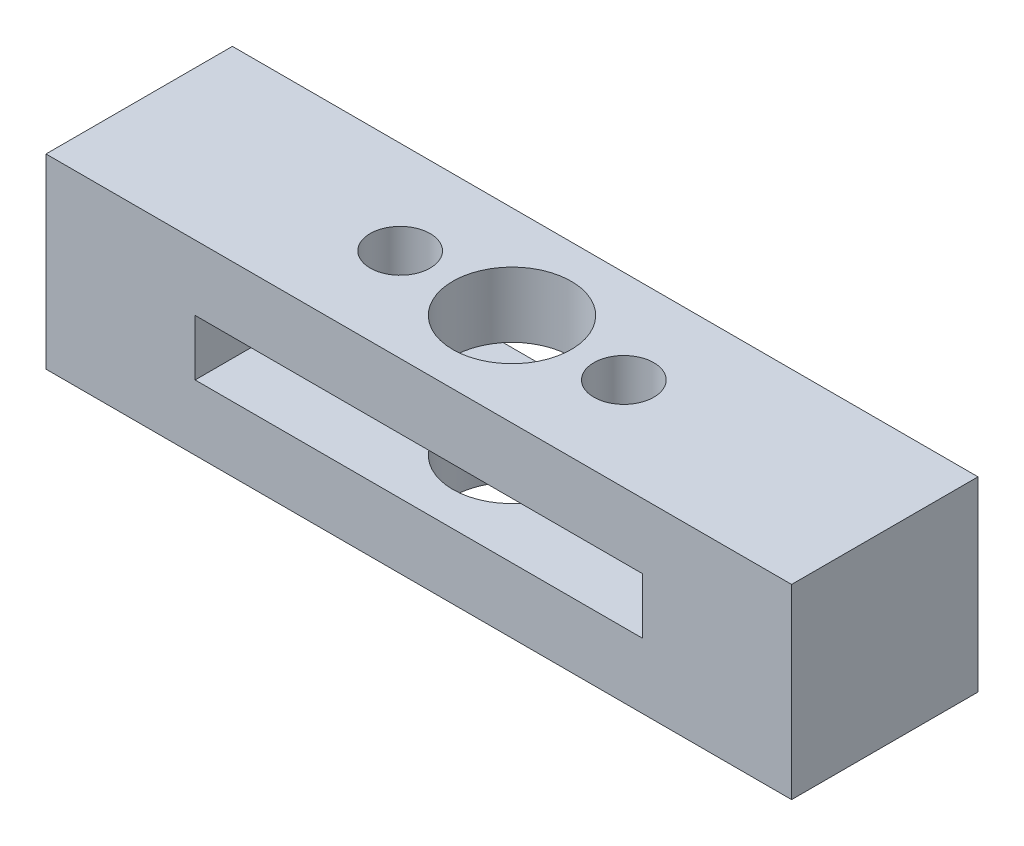
from build123d import *

# Parameters (mm, degrees)
SKETCH1_W               = 63.5
SKETCH1_H               = 15.875
SKETCH1_W_2             = 38.1
SKETCH1_H_2             = 4.7625
BOSS_EXTRUDE1_DEPTH     = 7.9375
F_1_4_20_TAPPED_HOLE1_D = 5.1054
F_3_8_CLEARANCE_HOLE1_D = 10.0838


with BuildPart() as part:
    # Sketch1 → Boss-Extrude1 (new, symmetric)
    with BuildSketch(Plane.XY):
        Rectangle(SKETCH1_W, SKETCH1_H)
        Rectangle(SKETCH1_W_2, SKETCH1_H_2, mode=Mode.SUBTRACT)
    extrude(amount=BOSS_EXTRUDE1_DEPTH, both=True)

    # 1/4-20 Tapped Hole1 (through all)
    with Locations(Plane(origin=(0, 7.9375, 0), x_dir=(1, 0, 0), z_dir=(0, 1, 0))):
        with Locations((9.525, 0), (-9.525, 0)):
            Hole(F_1_4_20_TAPPED_HOLE1_D / 2)

    # 3/8 Clearance Hole1 (through all)
    with Locations(Plane(origin=(0, 7.9375, 0), x_dir=(1, 0, 0), z_dir=(0, 1, 0))):
        with Locations((0, 0)):
            Hole(F_3_8_CLEARANCE_HOLE1_D / 2)


solid = part.part
